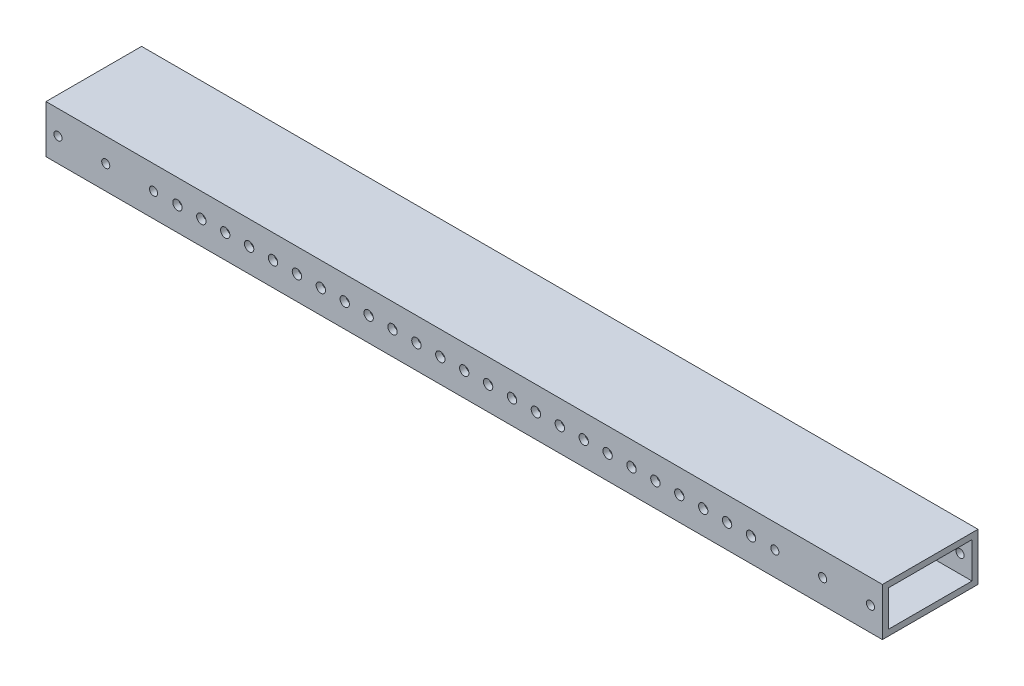
from build123d import *

# Parameters (mm, degrees)
SKETCH1_W           = 50.8
SKETCH1_H           = 25.4
BOSS_EXTRUDE1_DEPTH = 222.25
SHELL1_T            = -3.175
SKETCH2_R           = 2.15265
CUT_EXTRUDE1_DEPTH  = 230.392376726
SKETCH3_R           = 2.4892
CUT_EXTRUDE2_DEPTH  = 230.392376726
LPATTERN1_COUNT     = 25
LPATTERN1_PITCH     = 12.7


with BuildPart() as part:
    # Sketch1 → Boss-Extrude1 (new, symmetric)
    with BuildSketch(Plane(origin=(0, 0, 0), x_dir=(0, 0, -1), z_dir=(1, 0, 0))):
        with Locations((25.4, 12.7)):
            Rectangle(SKETCH1_W, SKETCH1_H)
    extrude(amount=BOSS_EXTRUDE1_DEPTH, both=True)

    # Shell1
    shell1_openings = [part.faces().sort_by_distance(p)[0] for p in [
        (222.25, 12.7, -25.4),
        (-222.25, 12.7, -25.4),
    ]]
    offset(amount=SHELL1_T, openings=shell1_openings, kind=Kind.INTERSECTION)

    # Sketch2 → Cut-Extrude1 (cut, through all)
    with BuildSketch(Plane.XY):
        with Locations((-215.9, 12.7)):
            Circle(SKETCH2_R)
        with Locations((-190.5, 12.7)):
            Circle(SKETCH2_R)
        with Locations((-165.1, 12.7)):
            Circle(SKETCH2_R)
    cut_extrude1 = extrude(amount=-CUT_EXTRUDE1_DEPTH, mode=Mode.SUBTRACT)

    # Sketch3 → Cut-Extrude2 (cut, through all)
    with BuildSketch(Plane.XY):
        with Locations((-152.4, 12.7)):
            Circle(SKETCH3_R)
    cut_extrude2 = extrude(amount=-CUT_EXTRUDE2_DEPTH, mode=Mode.SUBTRACT)

    # Mirror1: Cut-Extrude1 across plane
    add(cut_extrude1.mirror(Plane(origin=(0, 0, 0), x_dir=(0, 0, 1), z_dir=(1, 0, 0))), mode=Mode.SUBTRACT)

    # LPattern1: Cut-Extrude2 ×25
    with Locations(*[(i * LPATTERN1_PITCH, 0, 0) for i in range(1, LPATTERN1_COUNT)]):
        add(cut_extrude2, mode=Mode.SUBTRACT)


solid = part.part
